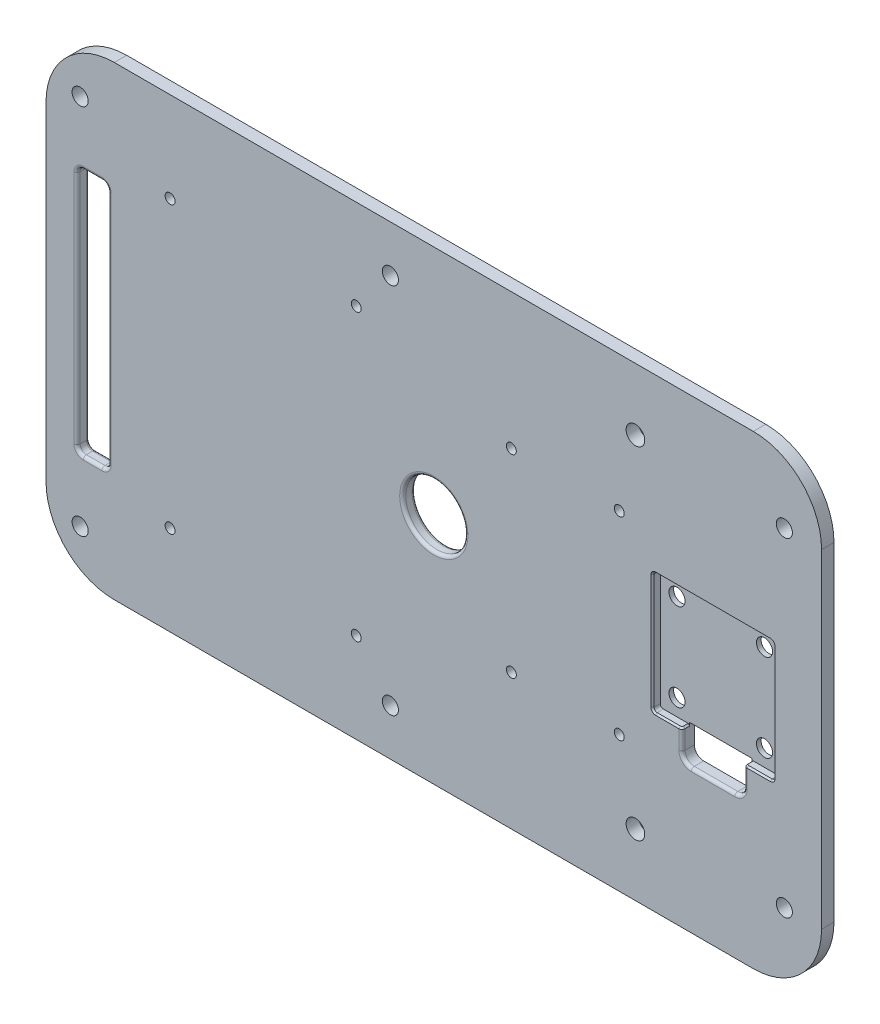
from build123d import *

# Parameters (mm, degrees)
SKETCH_1_R          = 2.6
SKETCH_1_R_2        = 1.6
SKETCH_1_R_3        = 10
SKETCH_1_R_4        = 3
SKETCH_1_W          = 20
SKETCH_1_H          = 10
EXTRUDE_1_DEPTH     = 4
SKETCH_2_W          = 39
SKETCH_2_H          = 39
CUT_EXTRUDE_1_DEPTH = 2.5
FILLET_1_R          = 3
FILLET_2_R          = 1
CHAMFER_1_SIZE      = 0.5
SKETCH_4_R          = 2.6
CUT_EXTRUDE_2_DEPTH = 2
FILLET_3_R          = 1
SKETCH_5_R          = 1.6
CUT_EXTRUDE_3_DEPTH = 146.828666592


with BuildPart() as part:
    # 草图1 → 凸台-拉伸1 (new body)
    with BuildSketch(Plane.XY):
        with BuildLine():
            Line((-103, -75), (103, -75))
            ThreePointArc((103, -75), (118.556349186, -68.556349186), (125, -53))
            Line((125, -53), (125, 53))
            ThreePointArc((125, 53), (118.556349186, 68.556349186), (103, 75))
            Line((103, 75), (-103, 75))
            ThreePointArc((-103, 75), (-118.556349186, 68.556349186), (-125, 53))
            Line((-125, 53), (-125, -53))
            ThreePointArc((-125, -53), (-118.556349186, -68.556349186), (-103, -75))
        make_face()
        with Locations((-114, 60)):
            Circle(SKETCH_1_R, mode=Mode.SUBTRACT)
        with Locations((-114, -60)):
            Circle(SKETCH_1_R, mode=Mode.SUBTRACT)
        with Locations((-14, -60)):
            Circle(SKETCH_1_R, mode=Mode.SUBTRACT)
        with Locations((-14, 60)):
            Circle(SKETCH_1_R, mode=Mode.SUBTRACT)
        with Locations((-85, 46)):
            Circle(SKETCH_1_R_2, mode=Mode.SUBTRACT)
        with Locations((-25, 46)):
            Circle(SKETCH_1_R_2, mode=Mode.SUBTRACT)
        with Locations((-25, -46)):
            Circle(SKETCH_1_R_2, mode=Mode.SUBTRACT)
        with Locations((-85, -46)):
            Circle(SKETCH_1_R_2, mode=Mode.SUBTRACT)
        Circle(SKETCH_1_R_3, mode=Mode.SUBTRACT)
        with Locations((65, -55)):
            Circle(SKETCH_1_R_4, mode=Mode.SUBTRACT)
        with Locations((65, 55)):
            Circle(SKETCH_1_R_4, mode=Mode.SUBTRACT)
        with Locations((113, 53)):
            Circle(SKETCH_1_R, mode=Mode.SUBTRACT)
        with Locations((113, -53)):
            Circle(SKETCH_1_R, mode=Mode.SUBTRACT)
        with BuildLine():
            Line((-113, -40), (-107, -40))
            ThreePointArc((-107, -40), (-105.585786438, -39.414213562), (-105, -38))
            Line((-105, -38), (-105, 38))
            ThreePointArc((-105, 38), (-105.585786438, 39.414213562), (-107, 40))
            Line((-107, 40), (-113, 40))
            ThreePointArc((-113, 40), (-114.414213562, 39.414213562), (-115, 38))
            Line((-115, 38), (-115, -38))
            ThreePointArc((-115, -38), (-114.414213562, -39.414213562), (-113, -40))
        make_face(mode=Mode.SUBTRACT)
        with Locations((90, -24)):
            Rectangle(SKETCH_1_W, SKETCH_1_H, mode=Mode.SUBTRACT)
    extrude(amount=EXTRUDE_1_DEPTH)

    # 草图2 → 切除-拉伸1 (cut)
    with BuildSketch(Plane.XY.offset(4)):
        with Locations((90, 0)):
            Rectangle(SKETCH_2_W, SKETCH_2_H)
    extrude(amount=-CUT_EXTRUDE_1_DEPTH, mode=Mode.SUBTRACT)

    # 圆角1
    fillet_1_edges = [part.edges().sort_by_distance(p)[0] for p in [
        (80, -29, 2),
        (100, -29, 2),
    ]]
    fillet(fillet_1_edges, radius=FILLET_1_R)

    # 圆角2
    fillet_2_edges = [part.edges().sort_by_distance(p)[0] for p in [
        (90, -29, 4),
        (80.878679656, -28.121320344, 4),
        (80, -22.75, 4),
        (70.5, -19.5, 2.75),
        (109.5, -19.5, 2.75),
        (109.5, 19.5, 2.75),
        (70.5, 19.5, 2.75),
        (99.121320344, -28.121320344, 4),
        (100, -22.75, 4),
    ]]
    fillet(fillet_2_edges, radius=FILLET_2_R)

    # 倒角1
    chamfer_1_edges = [part.edges().sort_by_distance(p)[0] for p in [
        (70.792893219, -19.207106781, 4),
        (109.207106781, -19.207106781, 4),
        (109.5, 0, 4),
        (109.207106781, 19.207106781, 4),
        (90, 19.5, 4),
        (70.792893219, 19.207106781, 4),
        (70.5, 0, 4),
        (104.75, -19.5, 4),
        (100, -19.5, 2.25),
        (100.292893219, -19.5, 3.707106781),
    ]]
    chamfer(chamfer_1_edges, length=CHAMFER_1_SIZE)

    # 草图4 → 切除-拉伸2 (cut)
    with BuildSketch(Plane.XY.offset(1.5)):
        with Locations((75.900290783, -14.099709217)):
            Circle(SKETCH_4_R)
        with Locations((104.099709217, -14.099709217)):
            Circle(SKETCH_4_R)
        with Locations((104.099709217, 14.099709217)):
            Circle(SKETCH_4_R)
        with Locations((75.900290783, 14.099709217)):
            Circle(SKETCH_4_R)
    extrude(amount=-CUT_EXTRUDE_2_DEPTH, mode=Mode.SUBTRACT)

    # 圆角3
    fillet_3_edges = [part.edges().sort_by_distance(p)[0] for p in [
        (-114.414213562, 39.414213562, 0),
        (-110, 40, 0),
        (-105.585786438, 39.414213562, 0),
        (-105, 0, 0),
        (-105.585786438, -39.414213562, 0),
        (-110, -40, 0),
        (-114.414213562, -39.414213562, 0),
        (-114.414213562, 39.414213562, 4),
        (-110, 40, 4),
        (-105.585786438, 39.414213562, 4),
        (-105, 0, 4),
        (-105.585786438, -39.414213562, 4),
        (-110, -40, 4),
        (-114.414213562, -39.414213562, 4),
        (-10, 0, 0),
        (-10, 0, 4),
        (-115, 0, 0),
        (-115, 0, 4),
    ]]
    fillet(fillet_3_edges, radius=FILLET_3_R)

    # 草图5 → 切除-拉伸3 (cut, through all)
    with BuildSketch(Plane.XY.offset(4)):
        with Locations((25, 31.24)):
            Circle(SKETCH_5_R)
        with Locations((59.79, 31.24)):
            Circle(SKETCH_5_R)
        with Locations((59.79, -31.24)):
            Circle(SKETCH_5_R)
        with Locations((25, -31.24)):
            Circle(SKETCH_5_R)
    extrude(amount=-CUT_EXTRUDE_3_DEPTH, mode=Mode.SUBTRACT)


solid = part.part
